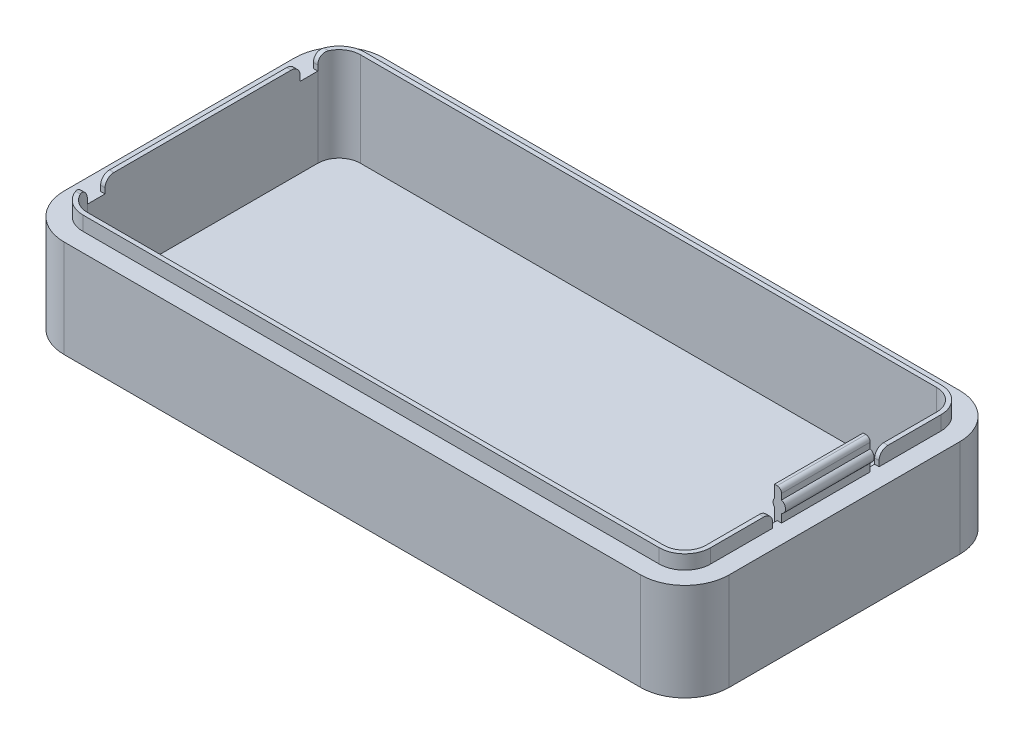
from build123d import *

# Parameters (mm, degrees)
EXTRUDE_2_DEPTH       = 11
EXTRUDE_4_DEPTH       = 1.6
CUT_EXTRUDE_START     = -9
CUT_EXTRUDE_2_DEPTH   = 9
EXTRUDE_12_DEPTH      = 1.6
EXTRUDE_12_DEPTH_BACK = 2
SKETCH_5_W            = 0.3
SKETCH_5_H            = 10
SKETCH_17_W           = 0.5
SKETCH_17_H           = 1
CUT_EXTRUDE_3_DEPTH   = 1.6
SKETCH_19_W           = 0.8
SKETCH_19_H           = 10
EXTRUDE_15_DEPTH      = 1.8
SKETCH_20_R           = 0.7
EXTRUDE_16_DEPTH      = 10
FILLET_4_R            = 0.5
SKETCH_50_W           = 0.5
SKETCH_50_H           = 2
CUT_EXTRUDE_10_DEPTH  = 1.6
FILLET_9_R            = 1
CUT_EXTRUDE_15_DEPTH  = 0.5


with BuildPart() as part:
    # case 2 → 凸台-拉伸2 (new body)
    with BuildSketch(Plane(origin=(0, 0, 0), x_dir=(1, 0, 0), z_dir=(0, 1, 0))):
        with BuildLine():
            Line((-34.042196447, 18), (30.957803553, 18))
            ThreePointArc((30.957803553, 18), (34.493337459, 16.535533906), (35.957803553, 13))
            Line((35.957803553, 13), (35.957803553, -13))
            ThreePointArc((35.957803553, -13), (34.493337459, -16.535533906), (30.957803553, -18))
            Line((30.957803553, -18), (-34.042196447, -18))
            ThreePointArc((-34.042196447, -18), (-37.577730353, -16.535533906), (-39.042196447, -13))
            Line((-39.042196447, -13), (-39.042196447, 13))
            ThreePointArc((-39.042196447, 13), (-37.577730353, 16.535533906), (-34.042196447, 18))
        make_face()
    extrude(amount=EXTRUDE_2_DEPTH)

    # 草图3 → 凸台-拉伸4 (add)
    with BuildSketch(Plane(origin=(0, 11, 0), x_dir=(1, 0, 0), z_dir=(0, 1, 0))):
        with BuildLine():
            Line((-36.942196447, 13), (-36.942196447, -13))
            ThreePointArc((-36.942196447, -13), (-36.092806113, -15.050609665), (-34.042196447, -15.9))
            Line((-34.042196447, -15.9), (30.957803553, -15.9))
            ThreePointArc((30.957803553, -15.9), (33.008413218, -15.050609665), (33.857803553, -13))
            Line((33.857803553, -13), (33.857803553, 13))
            ThreePointArc((33.857803553, 13), (33.008413218, 15.050609665), (30.957803553, 15.9))
            Line((30.957803553, 15.9), (-34.042196447, 15.9))
            ThreePointArc((-34.042196447, 15.9), (-36.092806113, 15.050609665), (-36.942196447, 13))
        make_face()
        with BuildLine():
            Line((-34.042196447, -15.4), (30.957803553, -15.4))
            ThreePointArc((30.957803553, -15.4), (32.654859828, -14.697056275), (33.357803553, -13))
            Line((33.357803553, -13), (33.357803553, 13))
            ThreePointArc((33.357803553, 13), (32.654859828, 14.697056275), (30.957803553, 15.4))
            Line((30.957803553, 15.4), (-34.042196447, 15.4))
            ThreePointArc((-34.042196447, 15.4), (-35.739252722, 14.697056275), (-36.442196447, 13))
            Line((-36.442196447, 13), (-36.442196447, -13))
            ThreePointArc((-36.442196447, -13), (-35.739252722, -14.697056275), (-34.042196447, -15.4))
        make_face(mode=Mode.SUBTRACT)
    extrude(amount=EXTRUDE_4_DEPTH)

    # 草图14 → 切除-拉伸2 (cut)
    with BuildSketch(Plane(origin=(0, 11, 0), x_dir=(1, 0, 0), z_dir=(0, 1, 0)).offset(CUT_EXTRUDE_START)):
        with BuildLine():
            Line((-34.042196447, -15.4), (30.957803553, -15.4))
            ThreePointArc((30.957803553, -15.4), (32.654859828, -14.697056275), (33.357803553, -13))
            Line((33.357803553, -13), (33.357803553, 13))
            ThreePointArc((33.357803553, 13), (32.654859828, 14.697056275), (30.957803553, 15.4))
            Line((30.957803553, 15.4), (-34.042196447, 15.4))
            ThreePointArc((-34.042196447, 15.4), (-35.739252722, 14.697056275), (-36.442196447, 13))
            Line((-36.442196447, 13), (-36.442196447, -13))
            ThreePointArc((-36.442196447, -13), (-35.739252722, -14.697056275), (-34.042196447, -15.4))
        make_face()
    extrude(amount=CUT_EXTRUDE_2_DEPTH, mode=Mode.SUBTRACT)

    # 草图5 → 凸台-拉伸12 (add, two sides: drawn at the far end of the back side and taken through both)
    with BuildSketch(Plane(origin=(0, 11, 0), x_dir=(1, 0, 0), z_dir=(0, 1, 0)).offset(-EXTRUDE_12_DEPTH_BACK)):
        with Locations((33.207803553, 0)):
            Rectangle(SKETCH_5_W, SKETCH_5_H)
    extrude(amount=EXTRUDE_12_DEPTH + EXTRUDE_12_DEPTH_BACK)

    # 草图17 → 切除-拉伸3 (cut)
    with BuildSketch(Plane(origin=(0, 12.6, 0), x_dir=(1, 0, 0), z_dir=(0, 1, 0))):
        with Locations((33.607803553, -5.5)):
            Rectangle(SKETCH_17_W, SKETCH_17_H)
        with Locations((33.607803553, 5.5)):
            Rectangle(SKETCH_17_W, SKETCH_17_H)
    extrude(amount=-CUT_EXTRUDE_3_DEPTH, mode=Mode.SUBTRACT)

    # 草图19 → 凸台-拉伸15 (add)
    with BuildSketch(Plane(origin=(0, 12.6, 0), x_dir=(1, 0, 0), z_dir=(0, 1, 0))):
        with Locations((33.457803553, 0)):
            Rectangle(SKETCH_19_W, SKETCH_19_H)
    extrude(amount=EXTRUDE_15_DEPTH)

    # 草图20 → 凸台-拉伸16 (add)
    with BuildSketch(Plane(origin=(0, 0, -5), x_dir=(-1, 0, 0), z_dir=(0, 0, -1))):
        with Locations((-33.607803553, 12.6)):
            Circle(SKETCH_20_R)
    extrude(amount=-EXTRUDE_16_DEPTH)

    # 圆角4
    fillet_4_edges = [part.edges().sort_by_distance(p)[0] for p in [
        (33.857803553, 14.4, 0),
    ]]
    fillet(fillet_4_edges, radius=FILLET_4_R)

    # 草图50 → 切除-拉伸10 (cut)
    with BuildSketch(Plane(origin=(0, 12.6, 0), x_dir=(1, 0, 0), z_dir=(0, 1, 0))):
        with Locations((-36.692196447, 12)):
            Rectangle(SKETCH_50_W, SKETCH_50_H)
        with Locations((-36.692196447, -12)):
            Rectangle(SKETCH_50_W, SKETCH_50_H)
    extrude(amount=-CUT_EXTRUDE_10_DEPTH, mode=Mode.SUBTRACT)

    # 圆角9
    fillet_9_edges = [part.edges().sort_by_distance(p)[0] for p in [
        (33.607803553, 12.6, 6),
        (33.607803553, 12.6, -6),
        (-36.692196447, 12.6, -13),
        (-36.692196447, 12.6, -11),
        (-36.692196447, 12.6, 11),
        (-36.692196447, 12.6, 13),
    ]]
    fillet(fillet_9_edges, radius=FILLET_9_R)

    # 草图62 → 切除-拉伸15 (cut)
    with BuildSketch(Plane.XZ):
        with BuildLine():
            Line((31.329867206, 13.332415894), (30.916899455, 13.564201315))
            Line((30.916899455, 13.564201315), (28.77453702, 14.767807833))
            Line((28.77453702, 14.767807833), (28.361536611, 15.002445177))
            add(Edge.make_bspline(
                [(28.361536611, 15.002445177), (28.226752403, 15.074974446), (28.078169451, 15.113170304), (27.930008551, 15.111473614)],
                knots=[3, 3, 3, 3, 4, 4, 4, 4], degree=3))
            add(Edge.make_bspline(
                [(27.930008551, 15.111473614), (27.781847651, 15.109776925), (27.634143582, 15.068188087), (27.501090445, 14.992591634)],
                knots=[4, 4, 4, 4, 5, 5, 5, 5], degree=3))
            Line((27.501090445, 14.992591634), (27.093536837, 14.748557578))
            Line((27.093536837, 14.748557578), (24.979299219, 13.496205892))
            Line((24.979299219, 13.496205892), (24.571712952, 13.255023759))
            add(Edge.make_bspline(
                [(24.571712952, 13.255023759), (24.308524118, 13.098142275), (24.146514419, 12.811335524), (24.150005577, 12.506475344)],
                knots=[8, 8, 8, 8, 9, 9, 9, 9], degree=3))
            Line((24.150005577, 12.506475344), (24.189028038, 9.098896372))
            add(Edge.make_bspline(
                [(24.189028038, 9.098896372), (24.192551656, 8.791201658), (24.361054378, 8.511014731), (24.627766829, 8.3602015)],
                knots=[10, 10, 10, 10, 11, 11, 11, 11], degree=3))
            Line((24.627766829, 8.3602015), (25.040769358, 8.128416478))
            Line((25.040769358, 8.128416478), (27.183131793, 6.924809959))
            Line((27.183131793, 6.924809959), (27.596166783, 6.690190404))
            add(Edge.make_bspline(
                [(27.596166783, 6.690190404), (27.73094907, 6.614791423), (27.879534142, 6.579447887), (28.027695042, 6.581144577)],
                knots=[14, 14, 14, 14, 15, 15, 15, 15], degree=3))
            add(Edge.make_bspline(
                [(28.027695042, 6.581144577), (28.175855942, 6.582841266), (28.323557891, 6.621577782), (28.456612949, 6.700043947)],
                knots=[15, 15, 15, 15, 16, 16, 16, 16], degree=3))
            Line((28.456612949, 6.700043947), (28.864131976, 6.944060215))
            Line((28.864131976, 6.944060215), (30.978369595, 8.196411901))
            Line((30.978369595, 8.196411901), (31.385921082, 8.437593635))
            add(Edge.make_bspline(
                [(31.385921082, 8.437593635), (31.651996619, 8.594508177), (31.811152075, 8.878447337), (31.807628458, 9.186142051)],
                knots=[19, 19, 19, 19, 20, 20, 20, 20], degree=3))
            Line((31.807628458, 9.186142051), (31.768605996, 12.593721022))
            add(Edge.make_bspline(
                [(31.768605996, 12.593721022), (31.765114839, 12.898581203), (31.59946636, 13.181635722), (31.329867206, 13.332415894)],
                knots=[21, 21, 21, 21, 22, 22, 22, 22], degree=3))
        make_face()
        with BuildLine():
            Line((25.122643227, 12.922239884), (27.737823659, 14.473836564))
            add(Edge.make_bspline(
                [(27.737823659, 14.473836564), (27.859536342, 14.546468245), (28.013401089, 14.548230253), (28.139562287, 14.478437141)],
                knots=[3, 3, 3, 3, 4, 4, 4, 4], degree=3))
            Line((28.139562287, 14.478437141), (30.775362017, 12.984120643))
            add(Edge.make_bspline(
                [(30.775362017, 12.984120643), (30.910144104, 12.908739052), (30.915214668, 12.715032206), (30.782227048, 12.633714516)],
                knots=[5, 5, 5, 5, 6, 6, 6, 6], degree=3))
            Line((30.782227048, 12.633714516), (28.255386484, 11.083146867))
            add(Edge.make_bspline(
                [(28.255386484, 11.083146867), (28.085552276, 10.981458533), (27.871866696, 10.979011477), (27.69978311, 11.076784282)],
                knots=[7, 7, 7, 7, 8, 8, 8, 8], degree=3))
            add(Edge.make_bspline(
                [(27.69978311, 11.076784282), (25.107151823, 12.534532657), (25.101415317, 12.537319262)],
                knots=[0, 0, 0, 1, 1, 1], degree=2))
            add(Edge.make_bspline(
                [(25.101415317, 12.537319262), (24.966404814, 12.632646927), (24.978280374, 12.837957024), (25.122643227, 12.922239884)],
                knots=[1, 1, 1, 1, 2, 2, 2, 2], degree=3))
        make_face(mode=Mode.SUBTRACT)
        with BuildLine():
            Line((29.074132094, 8.513698152), (28.779702541, 8.345067112))
            Line((28.779702541, 8.345067112), (28.773503452, 8.88639348))
            Line((28.773503452, 8.88639348), (29.034101238, 9.020461697))
            add(Edge.make_bspline(
                [(29.504843801, 9.718282469), (29.507943445, 9.44761059), (29.35685407, 9.20653087), (29.034101238, 9.020461697)],
                knots=[0, 0, 0, 0, 1, 1, 1, 1], degree=3))
            add(Edge.make_bspline(
                [(29.008019278, 9.806631855), (29.325033683, 9.992617921), (29.501646378, 9.997492729), (29.504843801, 9.718282469)],
                knots=[6, 6, 6, 6, 7, 7, 7, 7], degree=3))
            Line((29.008019278, 9.806631855), (28.764563572, 9.667055349))
            add(Edge.make_bspline(
                [(28.736598948, 9.618298227), (28.736370532, 9.638244301), (28.74754981, 9.658321013), (28.764563572, 9.667055349)],
                knots=[4, 4, 4, 4, 5, 5, 5, 5], degree=3))
            Line((28.736598948, 9.618298227), (28.74429897, 8.94590511))
            Line((28.74429897, 8.94590511), (28.751738116, 8.296292601))
            Line((28.751738116, 8.296292601), (28.761526341, 7.441550282))
            add(Edge.make_bspline(
                [(28.761526341, 7.441550282), (28.761754757, 7.421604207), (28.753429523, 7.404412477), (28.733631276, 7.392793957)],
                knots=[3, 3, 3, 3, 4, 4, 4, 4], degree=3))
            Line((28.733631276, 7.392793957), (28.184468761, 7.07306547))
            add(Edge.make_bspline(
                [(28.184468761, 7.07306547), (28.147656952, 7.052695223), (28.101767421, 7.077805604), (28.10127793, 7.120549676)],
                knots=[5, 5, 5, 5, 6, 6, 6, 6], degree=3))
            Line((28.10127793, 7.120549676), (28.071064911, 9.758857083))
            add(Edge.make_bspline(
                [(28.071064911, 9.758857083), (28.070836495, 9.778803157), (28.07916385, 9.798847209), (28.098994756, 9.807613806)],
                knots=[7, 7, 7, 7, 8, 8, 8, 8], degree=3))
            Line((28.098994756, 9.807613806), (29.033123907, 10.351169))
            add(Edge.make_bspline(
                [(29.033123907, 10.351169), (29.638896279, 10.702903644), (30.142382006, 10.777054965), (30.150212666, 10.093254154)],
                knots=[9, 9, 9, 9, 10, 10, 10, 10], degree=3))
            add(Edge.make_bspline(
                [(30.150212666, 10.093254154), (30.157749591, 9.435103264), (29.654400253, 8.850896635), (29.074132094, 8.513698152)],
                knots=[10, 10, 10, 10, 11, 11, 11, 11], degree=3))
        make_face(mode=Mode.SUBTRACT)
        with BuildLine():
            Line((31.023729103, 8.712692808), (30.480272555, 8.395881962))
            add(Edge.make_bspline(
                [(30.480272555, 8.395881962), (30.443460746, 8.375511715), (30.397571016, 8.400639486), (30.397081724, 8.443366168)],
                knots=[2, 2, 2, 2, 3, 3, 3, 3], degree=3))
            Line((30.397081724, 8.443366168), (30.382692922, 9.699847115))
            add(Edge.make_bspline(
                [(30.382692922, 9.699847115), (30.382464706, 9.7197758), (30.393676444, 9.737017977), (30.410657546, 9.748604237)],
                knots=[4, 4, 4, 4, 5, 5, 5, 5], degree=3))
            Line((30.410657546, 9.748604237), (30.954146555, 10.06258055))
            add(Edge.make_bspline(
                [(30.954146555, 10.06258055), (30.990958563, 10.082933407), (31.036848093, 10.057823026), (31.037337584, 10.015078954)],
                knots=[6, 6, 6, 6, 7, 7, 7, 7], degree=3))
            Line((31.037337584, 10.015078954), (31.051693528, 8.76146732))
            add(Edge.make_bspline(
                [(31.051693528, 8.76146732), (31.051921944, 8.741521246), (31.040742666, 8.721444534), (31.023729103, 8.712692808)],
                knots=[0, 0, 0, 0, 1, 1, 1, 1], degree=3))
        make_face(mode=Mode.SUBTRACT)
        with BuildLine():
            add(Edge.make_bspline(
                [(30.699564788, 10.894570885), (30.9175186, 11.022446162), (31.07482042, 10.970106055), (31.077104379, 10.770662702), (31.079355678, 10.574071274), (30.9253166, 10.341497274), (30.707330129, 10.21647392)],
                knots=[2, 2, 2, 2, 3, 3, 3, 4, 4, 4, 4], degree=3))
            add(Edge.make_bspline(
                [(30.707330129, 10.21647392), (30.486591832, 10.085714459), (30.329255233, 10.138054168), (30.327003933, 10.334645596), (30.324687315, 10.536940872), (30.478793832, 10.766663346), (30.699564788, 10.894570885)],
                knots=[0, 0, 0, 0, 1, 1, 1, 2, 2, 2, 2], degree=3))
        make_face(mode=Mode.SUBTRACT)
    extrude(amount=-CUT_EXTRUDE_15_DEPTH, mode=Mode.SUBTRACT)


solid = part.part
